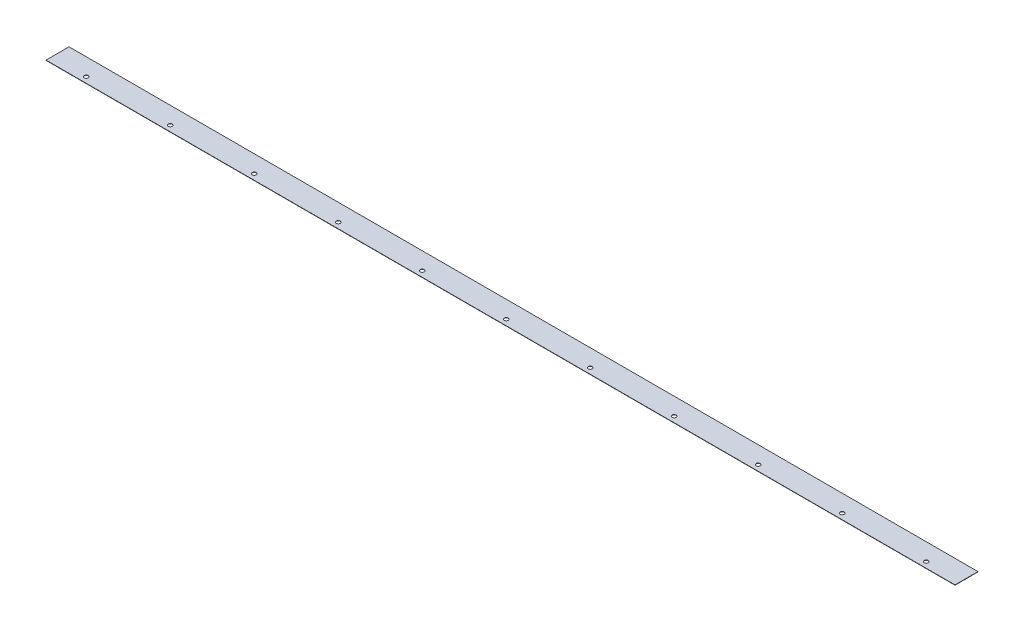
from build123d import *

# Parameters (mm, degrees)
SKETCH1_W           = 1580
SKETCH1_H           = 40
BASE_FLANGE1_DEPTH  = 0.5
SKETCH6_R           = 3.5
CUT_EXTRUDE1_DEPTH  = 10
LPATTERN1_COUNT     = 6
LPATTERN1_PITCH     = 146
LPATTERN1_COL_COUNT = 6
LPATTERN1_COL_PITCH = 146


# Sheet-metal steps are written as plain solids
with BuildPart() as part:
    # Sketch1 → Base-Flange1 (new body)
    with BuildSketch(Plane(origin=(0, 0, 0), x_dir=(1, 0, 0), z_dir=(0, 1, 0))):
        Rectangle(SKETCH1_W, SKETCH1_H)
    extrude(amount=-BASE_FLANGE1_DEPTH)

    # Sketch6 → Cut-Extrude1 (cut)
    with BuildSketch(Plane(origin=(0, 0, 0), x_dir=(1, 0, 0), z_dir=(0, 1, 0))):
        with Locations(Location((0, -10, 0), (0, 0, 270))):
            Circle(SKETCH6_R)
    cut_extrude1 = extrude(amount=-CUT_EXTRUDE1_DEPTH, mode=Mode.SUBTRACT)

    # LPattern1: Cut-Extrude1 ×6
    with Locations(*[(-i * LPATTERN1_PITCH, 0, 0) for i in range(1, LPATTERN1_COUNT)]):
        add(cut_extrude1, mode=Mode.SUBTRACT)

    # LPattern1 col: Cut-Extrude1 ×6
    with Locations(*[(i * LPATTERN1_COL_PITCH, 0, 0) for i in range(1, LPATTERN1_COL_COUNT)]):
        add(cut_extrude1, mode=Mode.SUBTRACT)


solid = part.part
